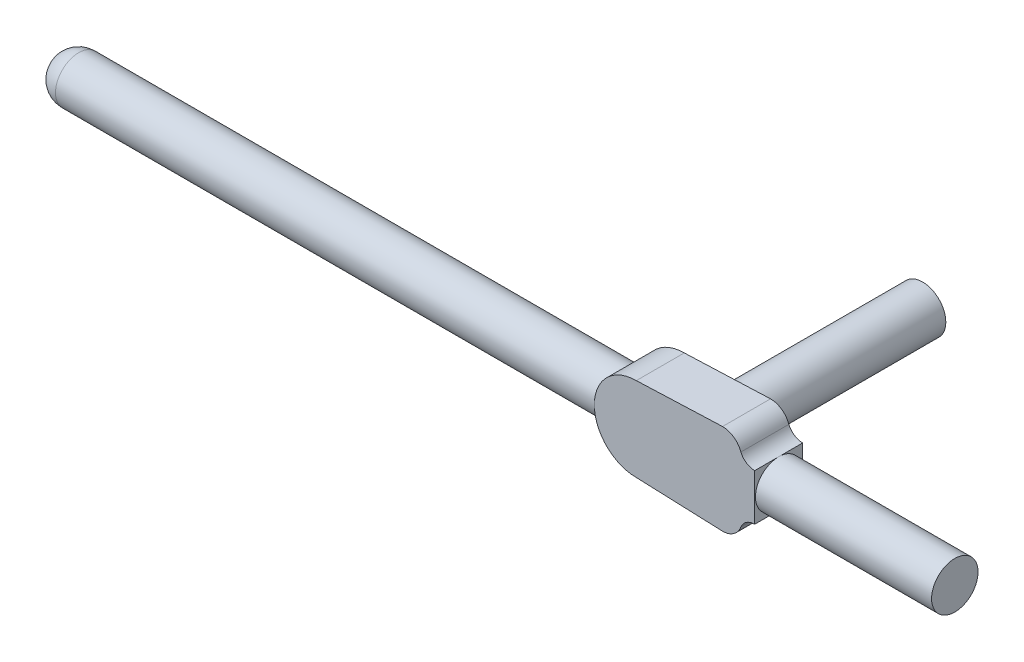
from build123d import *

# Parameters (mm, degrees)
SALIENTE_EXTRUIR1_DEPTH = 16
CROQUIS4_R              = 15.5
SALIENTE_EXTRUIR2_DEPTH = 133


with BuildPart() as part:
    # Croquis1 → Revolución1 (revolve)
    with BuildSketch(Plane.XY):
        with BuildLine():
            Line((-300, 0), (300, 0))
            Line((300, 0), (300, 15.5))
            Line((300, 15.5), (-284.5, 15.5))
            ThreePointArc((-284.5, 15.5), (-295.460155108, 10.960155108), (-300, 0))
        make_face()
    revolve(axis=Axis((-657.792003839, 0, 0), (1, 0, 0)))

    # Croquis3 → Saliente-Extruir1 (add, symmetric)
    with BuildSketch(Plane.XY):
        with BuildLine():
            Line((103.5, -28), (161.039643366, -30.25))
            ThreePointArc((161.039643366, -30.25), (168.527455009, -27.876978724), (173.281614908, -21.624257969))
            ThreePointArc((173.281614908, -21.624257969), (176.96634932, -17.170611658), (182.5, -15.5))
            Line((182.5, -15.5), (182.5, 15.5))
            ThreePointArc((182.5, 15.5), (176.96634932, 17.170611658), (173.281614908, 21.624257969))
            ThreePointArc((173.281614908, 21.624257969), (168.527455009, 27.876978724), (161.039643366, 30.25))
            Line((161.039643366, 30.25), (103.5, 28))
            ThreePointArc((103.5, 28), (75.5, 0), (103.5, -28))
        make_face()
    extrude(amount=SALIENTE_EXTRUIR1_DEPTH, both=True)

    # Croquis4 → Saliente-Extruir2 (add)
    with BuildSketch(Plane(origin=(0, 0, -16), x_dir=(-1, 0, 0), z_dir=(0, 0, -1))):
        with Locations((-129.5, 0)):
            Circle(CROQUIS4_R)
    extrude(amount=SALIENTE_EXTRUIR2_DEPTH)


solid = part.part
